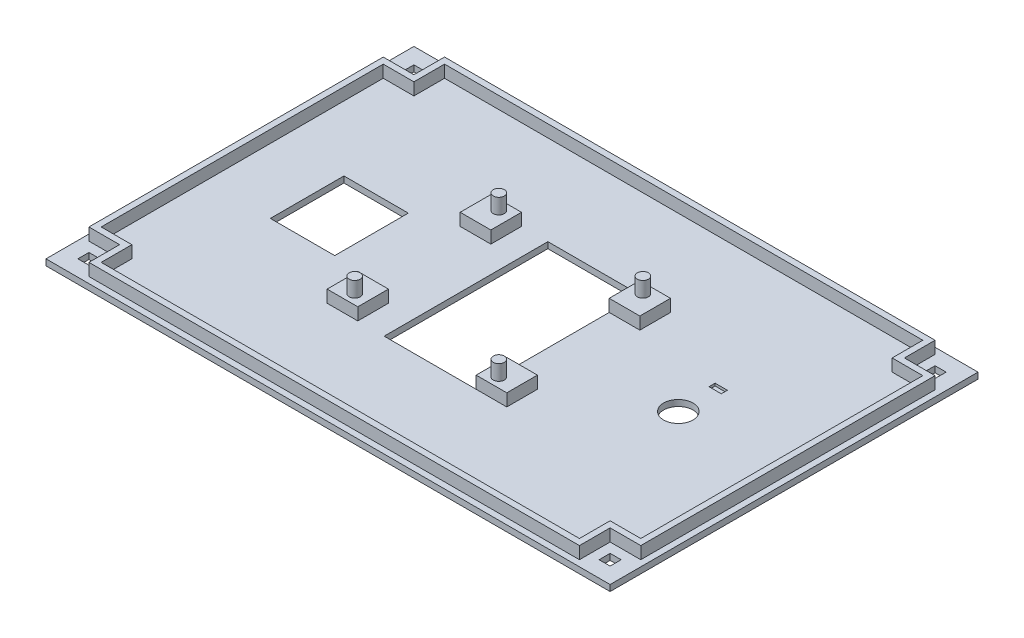
from build123d import *

# Parameters (mm, degrees)
SKETCH_1_W           = 92
SKETCH_1_H           = 60
EXTRUDE_1_DEPTH      = 1
EXTRUDE_3_DEPTH      = 2
SKETCH_6_W           = 1.8
SKETCH_6_H           = 1.8
CUT_EXTRUDE_3_DEPTH  = 1
SKETCH_7_W           = 1.8
SKETCH_7_H           = 1.8
CUT_EXTRUDE_4_DEPTH  = 1
SKETCH_8_W           = 1.8
SKETCH_8_H           = 1.8
CUT_EXTRUDE_5_DEPTH  = 1
SKETCH_9_W           = 1.8
SKETCH_9_H           = 1.8
CUT_EXTRUDE_6_DEPTH  = 1
SKETCH_15_W          = 15
SKETCH_15_H          = 26.7
CUT_EXTRUDE_8_DEPTH  = 1
SKETCH_18_W          = 5
SKETCH_18_H          = 5
EXTRUDE_4_DEPTH      = 2
SKETCH_19_R          = 0.9
EXTRUDE_5_DEPTH      = 2.5
SKETCH_10_W          = 10.5
SKETCH_10_H          = 12
CUT_EXTRUDE_9_DEPTH  = 1
SKETCH_20_R          = 2.4
CUT_EXTRUDE_11_DEPTH = 1
SKETCH_21_W          = 2
SKETCH_21_H          = 1
CUT_EXTRUDE_12_DEPTH = 0.4
CUT_EXTRUDE_13_DEPTH = 0.4


with BuildPart() as part:
    # Эскиз1 → Бобышка-Вытянуть1 (new body)
    with BuildSketch(Plane(origin=(0, 0, 0), x_dir=(1, 0, 0), z_dir=(0, 1, 0))):
        with Locations((46, 30)):
            Rectangle(SKETCH_1_W, SKETCH_1_H)
    extrude(amount=EXTRUDE_1_DEPTH)

    # Эскиз3 → Бобышка-Вытянуть3 (add)
    with BuildSketch(Plane(origin=(0, 1, 0), x_dir=(1, 0, 0), z_dir=(0, 1, 0))):
        Polygon((86, 54), (91, 54), (91, 6), (86, 6), (86, 1), (6, 1), (6, 6), (1, 6), (1, 54), (6, 54), (6, 59), (86, 59), align=None)
        Polygon((7, 58), (7, 53), (2, 53), (2, 7), (7, 7), (7, 2), (85, 2), (85, 7), (90, 7), (90, 53), (85, 53), (85, 58), align=None, mode=Mode.SUBTRACT)
    extrude(amount=EXTRUDE_3_DEPTH)

    # Эскиз6 → Вырез-Вытянуть3 (cut)
    with BuildSketch(Plane(origin=(0, 1, 0), x_dir=(1, 0, 0), z_dir=(0, 1, 0))):
        with Locations((3.5, 56.5)):
            Rectangle(SKETCH_6_W, SKETCH_6_H)
    extrude(amount=-CUT_EXTRUDE_3_DEPTH, mode=Mode.SUBTRACT)

    # Эскиз7 → Вырез-Вытянуть4 (cut)
    with BuildSketch(Plane(origin=(0, 1, 0), x_dir=(1, 0, 0), z_dir=(0, 1, 0))):
        with Locations((88.5, 56.5)):
            Rectangle(SKETCH_7_W, SKETCH_7_H)
    extrude(amount=-CUT_EXTRUDE_4_DEPTH, mode=Mode.SUBTRACT)

    # Эскиз8 → Вырез-Вытянуть5 (cut)
    with BuildSketch(Plane(origin=(0, 1, 0), x_dir=(1, 0, 0), z_dir=(0, 1, 0))):
        with Locations((88.5, 3.5)):
            Rectangle(SKETCH_8_W, SKETCH_8_H)
    extrude(amount=-CUT_EXTRUDE_5_DEPTH, mode=Mode.SUBTRACT)

    # Эскиз9 → Вырез-Вытянуть6 (cut)
    with BuildSketch(Plane(origin=(0, 1, 0), x_dir=(1, 0, 0), z_dir=(0, 1, 0))):
        with Locations((3.5, 3.5)):
            Rectangle(SKETCH_9_W, SKETCH_9_H)
    extrude(amount=-CUT_EXTRUDE_6_DEPTH, mode=Mode.SUBTRACT)

    # Эскиз15 → Вырез-Вытянуть8 (cut)
    with BuildSketch(Plane(origin=(0, 1, 0), x_dir=(1, 0, 0), z_dir=(0, 1, 0))):
        with Locations((46, 30)):
            Rectangle(SKETCH_15_W, SKETCH_15_H)
    extrude(amount=-CUT_EXTRUDE_8_DEPTH, mode=Mode.SUBTRACT)

    # Эскиз18 → Бобышка-Вытянуть4 (add)
    with BuildSketch(Plane(origin=(0, 1, 0), x_dir=(1, 0, 0), z_dir=(0, 1, 0))):
        with Locations((31.7, 40.85)):
            Rectangle(SKETCH_18_W, SKETCH_18_H)
        with Locations((31.7, 19.15)):
            Rectangle(SKETCH_18_W, SKETCH_18_H)
        with Locations((56, 40.85)):
            Rectangle(SKETCH_18_W, SKETCH_18_H)
        with Locations((56, 19.15)):
            Rectangle(SKETCH_18_W, SKETCH_18_H)
    extrude(amount=EXTRUDE_4_DEPTH)

    # Эскиз19 → Бобышка-Вытянуть5 (add)
    with BuildSketch(Plane(origin=(0, 3, 0), x_dir=(1, 0, 0), z_dir=(0, 1, 0))):
        with Locations((32.1, 41.75)):
            Circle(SKETCH_19_R)
        with Locations((32.1, 18.25)):
            Circle(SKETCH_19_R)
        with Locations((55.6, 41.75)):
            Circle(SKETCH_19_R)
        with Locations((55.6, 18.25)):
            Circle(SKETCH_19_R)
    extrude(amount=EXTRUDE_5_DEPTH)

    # Эскиз10 → Вырез-Вытянуть9 (cut)
    with BuildSketch(Plane(origin=(0, 1, 0), x_dir=(1, 0, 0), z_dir=(0, 1, 0))):
        with Locations((17.837788163, 30)):
            Rectangle(SKETCH_10_W, SKETCH_10_H)
    extrude(amount=-CUT_EXTRUDE_9_DEPTH, mode=Mode.SUBTRACT)

    # Эскиз20 → Вырез-Вытянуть11 (cut)
    with BuildSketch(Plane(origin=(0, 1, 0), x_dir=(1, 0, 0), z_dir=(0, 1, 0))):
        with Locations((73.124146683, 30)):
            Circle(SKETCH_20_R)
    extrude(amount=-CUT_EXTRUDE_11_DEPTH, mode=Mode.SUBTRACT)

    # Эскиз21 → Вырез-Вытянуть12 (cut)
    with BuildSketch(Plane(origin=(0, 1, 0), x_dir=(1, 0, 0), z_dir=(0, 1, 0))):
        with Locations((73.124146683, 36.5)):
            Rectangle(SKETCH_21_W, SKETCH_21_H)
    extrude(amount=-CUT_EXTRUDE_12_DEPTH, mode=Mode.SUBTRACT)

    # Эскиз22 → Вырез-Вытянуть13 (cut)
    # profile 1 of 19: a face of its own
    with BuildSketch(Plane(origin=(0, 0, 0), x_dir=(-1, 0, 0), z_dir=(0, -1, 0))):
        with BuildLine():
            Line((-6.570655821, 25.424472737), (-6.469404796, 25.859111284))
            add(Edge.make_bspline(
                [(-6.469404796, 25.859111284), (-6.42866707, 25.848222688), (-6.348979021, 25.826923244), (-6.234941019, 25.784806046), (-6.127904498, 25.737555442), (-6.028228713, 25.683932135), (-5.936347059, 25.62376797), (-5.851798196, 25.557325766), (-5.774447685, 25.484615344), (-5.705249825, 25.405078748), (-5.64335716, 25.320786828), (-5.590308991, 25.231149588), (-5.544050852, 25.13775734), (-5.506972443, 25.039082562), (-5.478848705, 24.935849752), (-5.458415772, 24.828316195), (-5.44581431, 24.716220632), (-5.444156624, 24.639810452), (-5.44331209, 24.600882082)],
                knots=[0, 0, 0, 0, 1.145367768, 2.240481511, 3.299486216, 4.322926322, 5.312543435, 6.280301985, 7.2416403, 8.192823262, 9.141388579, 10.079393599, 11.019812878, 11.970222822, 12.938950422, 13.923894909, 14.942295558, 16, 16, 16, 16], degree=3))
            add(Edge.make_bspline(
                [(-5.44331209, 24.600882082), (-5.443899781, 24.560942698), (-5.445049549, 24.482804485), (-5.454179645, 24.368307837), (-5.470558105, 24.259560116), (-5.491508604, 24.156173744), (-5.520271057, 24.058881927), (-5.554583179, 23.966980521), (-5.596126954, 23.881262605), (-5.64325851, 23.800821066), (-5.696831647, 23.726033128), (-5.755366986, 23.655188809), (-5.820484911, 23.590010412), (-5.890645542, 23.52886757), (-5.966775043, 23.473092173), (-6.047838988, 23.420632185), (-6.135265768, 23.37404816), (-6.227434476, 23.331613726), (-6.323452756, 23.294368116), (-6.421423981, 23.261418779), (-6.52154337, 23.234480895), (-6.622968435, 23.211289115), (-6.726552598, 23.194441411), (-6.831518662, 23.181064855), (-6.938510159, 23.173710156), (-7.010429062, 23.172742355), (-7.046659116, 23.172254813)],
                knots=[0, 0, 0, 0, 1.180680974, 2.309907975, 3.39230657, 4.430402719, 5.425739985, 6.38846843, 7.327253855, 8.238163682, 9.141319901, 10.044148192, 10.951882972, 11.861898394, 12.79276478, 13.739539846, 14.714057202, 15.718574761, 16.737652364, 17.7573291, 18.772768038, 19.801551793, 20.831755737, 21.873891013, 22.928945814, 24, 24, 24, 24], degree=3))
            add(Edge.make_bspline(
                [(-7.046659116, 23.172254813), (-7.085770876, 23.172952237), (-7.163045836, 23.17433017), (-7.277068033, 23.182105104), (-7.387110534, 23.196395531), (-7.493258994, 23.21620551), (-7.595742304, 23.241444119), (-7.694584556, 23.272170252), (-7.789383645, 23.308824995), (-7.880165198, 23.350454956), (-7.965820446, 23.3983352), (-8.047112416, 23.449875639), (-8.12245872, 23.50713182), (-8.193247002, 23.568128034), (-8.258272467, 23.634435586), (-8.317689317, 23.705839429), (-8.372037669, 23.781726863), (-8.420813468, 23.862085913), (-8.463611654, 23.945866435), (-8.501732378, 24.031823953), (-8.532977491, 24.120300374), (-8.558956548, 24.210594228), (-8.57963829, 24.30289991), (-8.593468235, 24.397433102), (-8.602480899, 24.494106454), (-8.603702331, 24.559291178), (-8.604319703, 24.592238701)],
                knots=[0, 0, 0, 0, 1.185610122, 2.34246615, 3.46204209, 4.547238403, 5.613845268, 6.659506797, 7.682407252, 8.692734231, 9.683951048, 10.654680354, 11.607833779, 12.549673105, 13.484816388, 14.419272854, 15.362680812, 16.31159957, 17.265732262, 18.21261905, 19.159670199, 20.10733745, 21.059306249, 22.024427552, 23.00144979, 24, 24, 24, 24], degree=3))
            add(Edge.make_bspline(
                [(-8.604319703, 24.592238701), (-8.603652237, 24.629108303), (-8.602340266, 24.701579156), (-8.590721426, 24.807782632), (-8.573311226, 24.909922408), (-8.547027641, 25.007202849), (-8.514784453, 25.100540365), (-8.473198343, 25.188464658), (-8.426078288, 25.272764465), (-8.37074248, 25.351878016), (-8.30900408, 25.426041853), (-8.241014787, 25.494587517), (-8.167224578, 25.557389804), (-8.087056239, 25.61367133), (-8.001050806, 25.664204492), (-7.909376708, 25.709532327), (-7.811449519, 25.748574864), (-7.743231079, 25.769454459), (-7.708495084, 25.780086093)],
                knots=[0, 0, 0, 0, 1.098215313, 2.158650937, 3.179873416, 4.182349117, 5.157851008, 6.118027029, 7.076341197, 8.032298369, 8.990121974, 9.948357669, 10.905435138, 11.873450097, 12.863034414, 13.874936208, 14.917943528, 16, 16, 16, 16], degree=3))
            Line((-7.708495084, 25.780086093), (-7.615270055, 25.345447547))
            add(Edge.make_bspline(
                [(-7.615270055, 25.345447547), (-7.641927536, 25.336911924), (-7.694104473, 25.320205069), (-7.768465881, 25.290540415), (-7.837497564, 25.258503577), (-7.900730274, 25.223331412), (-7.958179157, 25.184947695), (-8.010542419, 25.1442363), (-8.056842693, 25.100221824), (-8.098147547, 25.053799556), (-8.13333533, 25.00377074), (-8.164517496, 24.951308266), (-8.190315984, 24.895305965), (-8.212136175, 24.83656947), (-8.228743691, 24.774549778), (-8.240427734, 24.709499442), (-8.247189886, 24.641361307), (-8.248194152, 24.594928994), (-8.248706346, 24.571247635)],
                knots=[0, 0, 0, 0, 1.235697765, 2.418642872, 3.532555292, 4.594392283, 5.610119701, 6.580908344, 7.519430642, 8.427315627, 9.319973334, 10.216139639, 11.118687699, 12.038725643, 12.980015607, 13.949697744, 14.954307006, 16, 16, 16, 16], degree=3))
            add(Edge.make_bspline(
                [(-8.248706346, 24.571247635), (-8.248311504, 24.54405943), (-8.247534966, 24.490588254), (-8.239048929, 24.412029901), (-8.226523283, 24.336597086), (-8.207835559, 24.264803466), (-8.184238667, 24.196509333), (-8.156046818, 24.131405139), (-8.121735943, 24.069921589), (-8.082406539, 24.012121135), (-8.038255026, 23.958332122), (-7.990821012, 23.908365172), (-7.939993445, 23.862346005), (-7.885470108, 23.820826752), (-7.827051837, 23.783799683), (-7.765294928, 23.750291573), (-7.699786217, 23.721359095), (-7.607900086, 23.688657143), (-7.489324729, 23.656503936), (-7.344311841, 23.6279352), (-7.197137773, 23.609921214), (-7.098158192, 23.607904779), (-7.048511269, 23.60689336)],
                knots=[0, 0, 0, 0, 0.935100075, 1.839065892, 2.715632844, 3.564034634, 4.388093667, 5.199800233, 6.00171917, 6.806945003, 7.602082793, 8.393428172, 9.17553264, 9.958694158, 10.748327009, 11.553054559, 12.374096334, 13.209545573, 14.906836637, 16.595465087, 18.292327764, 20, 20, 20, 20], degree=3))
            add(Edge.make_bspline(
                [(-7.048511269, 23.60689336), (-6.986089569, 23.608046769), (-6.864781408, 23.610288264), (-6.689243263, 23.631868524), (-6.525589101, 23.665301569), (-6.398054296, 23.705251574), (-6.303847959, 23.745439215), (-6.237872901, 23.777935197), (-6.176823035, 23.815029589), (-6.120351314, 23.855798002), (-6.068622551, 23.900766021), (-6.021361937, 23.949307034), (-5.978114719, 24.001431916), (-5.940905377, 24.05775829), (-5.907866726, 24.116118084), (-5.878488127, 24.175774845), (-5.853641008, 24.236766133), (-5.834339262, 24.299338023), (-5.817659869, 24.362611838), (-5.806764107, 24.427284473), (-5.800614882, 24.493337486), (-5.799493107, 24.537690452), (-5.798925447, 24.560134718)],
                knots=[0, 0, 0, 0, 2.106854985, 4.094388766, 5.961441423, 7.741458329, 8.594569961, 9.418076185, 10.222480919, 11.003619353, 11.767127393, 12.533696482, 13.289066307, 14.050325982, 14.809648647, 15.552384038, 16.294338903, 17.030544626, 17.761979889, 18.502240791, 19.242077596, 20, 20, 20, 20], degree=3))
            add(Edge.make_bspline(
                [(-5.798925447, 24.560134718), (-5.799487167, 24.586918876), (-5.800596763, 24.639827059), (-5.810309118, 24.717397174), (-5.824621544, 24.792173695), (-5.846707062, 24.863250716), (-5.873748192, 24.931584302), (-5.907094634, 24.996614577), (-5.947200671, 25.058137031), (-5.992737308, 25.116875304), (-6.044550221, 25.171746209), (-6.102221977, 25.222032443), (-6.166015495, 25.267144877), (-6.234906982, 25.308975455), (-6.310954481, 25.344120829), (-6.391891351, 25.376673744), (-6.47904786, 25.403799184), (-6.53968118, 25.41748256), (-6.570655821, 25.424472737)],
                knots=[0, 0, 0, 0, 1.013374089, 2.001772144, 2.95501459, 3.891367103, 4.814208647, 5.733921849, 6.652182523, 7.590185968, 8.54346024, 9.504121027, 10.481158517, 11.497760682, 12.549996529, 13.647863555, 14.798406869, 16, 16, 16, 16], degree=3))
        make_face()
    # profile 2 of 19: a face of its own
    with BuildSketch(Plane(origin=(0, 0, 0), x_dir=(-1, 0, 0), z_dir=(0, -1, 0))):
        Polygon((-5.482824686, 27.163026924), (-8.209193751, 27.163026924), (-8.209193751, 26.175212045), (-8.564807107, 26.175212045), (-8.564807107, 28.585480349), (-8.209193751, 28.585480349), (-8.209193751, 27.59766547), (-5.482824686, 27.59766547), align=None)
    # profile 3 of 19: a face of its own
    with BuildSketch(Plane(origin=(0, 0, 0), x_dir=(-1, 0, 0), z_dir=(0, -1, 0))):
        Polygon((-5.482824686, 28.598445419), (-8.564807107, 29.8221011), (-8.564807107, 30.312304234), (-5.482824686, 31.535959915), (-5.482824686, 31.074773844), (-6.431126969, 30.724099562), (-6.431126969, 29.410305773), (-5.482824686, 29.059631491), align=None)
        with BuildLine():
            Line((-6.786740326, 29.541191244), (-6.786740326, 30.59321409))
            Line((-6.786740326, 30.59321409), (-7.596748526, 30.293782705))
            add(Edge.make_bspline(
                [(-7.596748526, 30.293782705), (-7.628046139, 30.282303575), (-7.689238882, 30.259859708), (-7.778146772, 30.22638914), (-7.862577353, 30.195810969), (-7.941320012, 30.165826561), (-8.015518565, 30.138759101), (-8.084671835, 30.113810329), (-8.148299173, 30.089136203), (-8.18940899, 30.074328914), (-8.209193751, 30.067202667)],
                knots=[0, 0, 0, 0, 1.225184869, 2.395467751, 3.491410812, 4.525364584, 5.492066482, 6.394148129, 7.227157926, 8, 8, 8, 8], degree=3))
            add(Edge.make_bspline(
                [(-8.209193751, 30.067202667), (-8.160416394, 30.05538553), (-8.062470839, 30.031656567), (-7.919065716, 29.982602177), (-7.777293459, 29.925566329), (-7.685972956, 29.879754666), (-7.639965427, 29.856674621)],
                knots=[0, 0, 0, 0, 0.989154277, 1.986234384, 2.985459177, 4, 4, 4, 4], degree=3))
            Line((-7.639965427, 29.856674621), (-6.786740326, 29.541191244))
        make_face(mode=Mode.SUBTRACT)
    # profile 4 of 19: a face of its own
    with BuildSketch(Plane(origin=(0, 0, 0), x_dir=(-1, 0, 0), z_dir=(0, -1, 0))):
        with BuildLine():
            Line((-5.482824686, 31.865025747), (-8.564807107, 31.865025747))
            Line((-8.564807107, 31.865025747), (-8.564807107, 32.997308551))
            add(Edge.make_bspline(
                [(-8.564807107, 32.997308551), (-8.564539731, 33.044240761), (-8.564037596, 33.132379671), (-8.558156955, 33.255464526), (-8.550881628, 33.36115949), (-8.540523454, 33.424999673), (-8.535790045, 33.454172933)],
                knots=[0, 0, 0, 0, 1.22865052, 2.30741144, 3.226532197, 4, 4, 4, 4], degree=3))
            add(Edge.make_bspline(
                [(-8.535790045, 33.454172933), (-8.529028905, 33.489788154), (-8.515911953, 33.558883475), (-8.482717393, 33.656093917), (-8.444028926, 33.745521834), (-8.39417145, 33.825471011), (-8.335962557, 33.89815412), (-8.26610319, 33.962267606), (-8.186275746, 34.0191097), (-8.096508556, 34.067440001), (-7.99992137, 34.107668366), (-7.897021967, 34.135844275), (-7.789598843, 34.153891045), (-7.716183373, 34.155790584), (-7.678860638, 34.156756265)],
                knots=[0, 0, 0, 0, 1.070963964, 2.077723998, 3.031409109, 3.947034396, 4.855896512, 5.777672756, 6.742175787, 7.747333477, 8.787332885, 9.830036646, 10.896840568, 12, 12, 12, 12], degree=3))
            add(Edge.make_bspline(
                [(-7.678860638, 34.156756265), (-7.646927322, 34.156075709), (-7.584096773, 34.154736676), (-7.491789627, 34.143238617), (-7.402986408, 34.125103689), (-7.318294771, 34.098052996), (-7.236724727, 34.064982757), (-7.159651468, 34.023306763), (-7.086030303, 33.974640418), (-7.016054347, 33.91880708), (-6.951171344, 33.853067705), (-6.896045733, 33.774007135), (-6.850069737, 33.682929919), (-6.81152558, 33.580562998), (-6.783413803, 33.465819886), (-6.76150012, 33.339647281), (-6.749726443, 33.201061712), (-6.748081964, 33.10475323), (-6.74722773, 33.054725291)],
                knots=[0, 0, 0, 0, 0.928734587, 1.827336177, 2.702165944, 3.561887964, 4.410255795, 5.259404997, 6.106313752, 6.974995773, 7.859929622, 8.783555066, 9.766301868, 10.821656499, 11.958701757, 13.197967894, 14.544469954, 16, 16, 16, 16], degree=3))
            Line((-6.74722773, 33.054725291), (-6.74722773, 32.299664293))
            Line((-6.74722773, 32.299664293), (-5.482824686, 32.299664293))
            Line((-5.482824686, 32.299664293), (-5.482824686, 31.865025747))
        make_face()
        with BuildLine():
            Line((-7.102841087, 32.299664293), (-7.102841087, 33.04299499))
            add(Edge.make_bspline(
                [(-7.102841087, 33.04299499), (-7.103338695, 33.072641308), (-7.104297291, 33.129752193), (-7.110936016, 33.212284985), (-7.12255733, 33.287993406), (-7.138374832, 33.357311063), (-7.159355737, 33.419723831), (-7.184438848, 33.475930209), (-7.214833999, 33.52508947), (-7.249894819, 33.567710097), (-7.289194646, 33.604281705), (-7.332050181, 33.636001626), (-7.37867225, 33.662744499), (-7.429151605, 33.68417138), (-7.482930117, 33.701879791), (-7.541029035, 33.713074677), (-7.602507074, 33.720826432), (-7.644878515, 33.721681255), (-7.666512952, 33.722117719)],
                knots=[0, 0, 0, 0, 1.40421292, 2.705086056, 3.918275699, 5.029558377, 6.068365212, 7.032404237, 7.938575147, 8.797260087, 9.638618655, 10.474993364, 11.317706051, 12.177828306, 13.068718597, 13.993981992, 14.975747128, 16, 16, 16, 16], degree=3))
            add(Edge.make_bspline(
                [(-7.666512952, 33.722117719), (-7.697885669, 33.721195832), (-7.758675041, 33.719409536), (-7.846166858, 33.701452155), (-7.926944323, 33.673214031), (-7.999645608, 33.633161105), (-8.062709721, 33.583626294), (-8.115710352, 33.527139091), (-8.156346429, 33.462215341), (-8.173407839, 33.414627917), (-8.182028842, 33.39058235)],
                knots=[0, 0, 0, 0, 1.143451971, 2.215610693, 3.244091205, 4.255765529, 5.229231363, 6.159234871, 7.069875225, 8, 8, 8, 8], degree=3))
            add(Edge.make_bspline(
                [(-8.182028842, 33.39058235), (-8.184187476, 33.381754378), (-8.188878337, 33.362570588), (-8.194202534, 33.33079279), (-8.199244076, 33.293963997), (-8.202588905, 33.251904686), (-8.205910745, 33.204998428), (-8.20744203, 33.153101824), (-8.208764625, 33.096096656), (-8.209046339, 33.056372705), (-8.209193751, 33.035586378)],
                knots=[0, 0, 0, 0, 0.611063981, 1.327884044, 2.165719042, 3.110592661, 4.16481496, 5.328235826, 6.601947678, 8, 8, 8, 8], degree=3))
            Line((-8.209193751, 33.035586378), (-8.209193751, 32.299664293))
            Line((-8.209193751, 32.299664293), (-7.102841087, 32.299664293))
        make_face(mode=Mode.SUBTRACT)
    # profile 5 of 19: a face of its own
    with BuildSketch(Plane(origin=(0, 0, 0), x_dir=(-1, 0, 0), z_dir=(0, -1, 0))):
        Polygon((-5.482824686, 35.460671905), (-8.209193751, 35.460671905), (-8.209193751, 34.472857027), (-8.564807107, 34.472857027), (-8.564807107, 36.883125331), (-8.209193751, 36.883125331), (-8.209193751, 35.895310452), (-5.482824686, 35.895310452), align=None)
    # profile 6 of 19: a face of its own
    with BuildSketch(Plane(origin=(0, 0, 0), x_dir=(-1, 0, 0), z_dir=(0, -1, 0))):
        with BuildLine():
            Line((-64.174693356, 41.054203842), (-64.490794117, 41.054203842))
            add(Edge.make_bspline(
                [(-64.490794117, 41.054203842), (-64.486314994, 41.084573701), (-64.477957245, 41.141241868), (-64.456640395, 41.218419293), (-64.426859406, 41.280549481), (-64.390167209, 41.329253258), (-64.345584748, 41.364660451), (-64.297145222, 41.393671519), (-64.242536648, 41.414428898), (-64.192436952, 41.426523544), (-64.146532776, 41.432316535), (-64.104217722, 41.437719455), (-64.054325287, 41.440910537), (-63.99691182, 41.444083618), (-63.93207281, 41.446405071), (-63.859634358, 41.448473056), (-63.779771814, 41.448639335), (-63.724002303, 41.449093496), (-63.694985755, 41.449329794)],
                knots=[0, 0, 0, 0, 1.447810451, 2.70151949, 3.761071597, 4.681645368, 5.550644144, 6.429888993, 7.336843752, 8.295347529, 8.854221167, 9.519029888, 10.307665071, 11.211965247, 12.232216441, 13.368617127, 14.630907028, 16, 16, 16, 16], degree=3))
            add(Edge.make_bspline(
                [(-63.694985755, 41.449329794), (-63.65629207, 41.449499573), (-63.58217048, 41.449824803), (-63.475710669, 41.454118012), (-63.37892755, 41.461419035), (-63.291616803, 41.471303461), (-63.213699173, 41.482912533), (-63.145693612, 41.499061098), (-63.087149765, 41.517316173), (-63.022233859, 41.544757685), (-62.953235849, 41.59025434), (-62.882123402, 41.656871497), (-62.824613218, 41.738370573), (-62.780408946, 41.83365436), (-62.746011398, 41.942256295), (-62.721692445, 42.065103297), (-62.70412593, 42.201875137), (-62.700045047, 42.297969224), (-62.697910112, 42.348241333)],
                knots=[0, 0, 0, 0, 1.168079359, 2.237571843, 3.215832227, 4.097464159, 4.89008186, 5.592324794, 6.205352649, 6.73969271, 7.715108044, 8.68195796, 9.666354411, 10.705682302, 11.841323562, 13.097561565, 14.481574619, 16, 16, 16, 16], degree=3))
            add(Edge.make_bspline(
                [(-62.697910112, 42.348241333), (-62.722657161, 42.311453134), (-62.770782121, 42.239912055), (-62.854025536, 42.144644926), (-62.944118629, 42.064587508), (-63.039836221, 41.997830299), (-63.142639054, 41.947178823), (-63.251270267, 41.91015278), (-63.36647997, 41.88820434), (-63.44546859, 41.885397623), (-63.485692478, 41.88396834)],
                knots=[0, 0, 0, 0, 1.110237516, 2.159050787, 3.15987179, 4.123962007, 5.074118526, 6.021584412, 6.992518568, 8, 8, 8, 8], degree=3))
            add(Edge.make_bspline(
                [(-63.485692478, 41.88396834), (-63.522576973, 41.884928096), (-63.594979339, 41.886812046), (-63.701275417, 41.901339716), (-63.802777475, 41.925054597), (-63.899169707, 41.959639359), (-63.991033742, 42.00251579), (-64.077272828, 42.056500148), (-64.159266649, 42.118966972), (-64.235415482, 42.190976744), (-64.30471568, 42.271292045), (-64.365377739, 42.358948992), (-64.416071646, 42.453825647), (-64.458685186, 42.554878466), (-64.490046839, 42.663412013), (-64.51400039, 42.778291976), (-64.527241316, 42.90007974), (-64.529270017, 42.983500232), (-64.530306712, 43.026129294)],
                knots=[0, 0, 0, 0, 1.017020763, 1.996359424, 2.953184604, 3.886712106, 4.815985037, 5.743748632, 6.687145925, 7.654818974, 8.628780691, 9.608086455, 10.58837866, 11.590850207, 12.627076538, 13.699062132, 14.824187913, 16, 16, 16, 16], degree=3))
            add(Edge.make_bspline(
                [(-64.530306712, 43.026129294), (-64.529817207, 43.058659015), (-64.528858795, 43.122349663), (-64.521829341, 43.215466101), (-64.511346036, 43.304276559), (-64.494051027, 43.388169861), (-64.474233829, 43.468227656), (-64.448758042, 43.543455004), (-64.419269599, 43.614456532), (-64.373313359, 43.70111143), (-64.309291727, 43.799845378), (-64.226347774, 43.907451875), (-64.134770148, 43.999021269), (-64.053178024, 44.06533064), (-63.98258761, 44.109740046), (-63.924954748, 44.137940764), (-63.862805003, 44.162112757), (-63.796140544, 44.181929293), (-63.72476789, 44.196227262), (-63.649210907, 44.207773419), (-63.568920962, 44.2135035), (-63.513893067, 44.214632742), (-63.485692478, 44.215211454)],
                knots=[0, 0, 0, 0, 1.093679396, 2.141338684, 3.138679113, 4.098139365, 5.019539308, 5.910153341, 6.766085864, 7.601779376, 9.204576951, 10.717610798, 12.161066056, 13.549758896, 14.242914697, 14.960875658, 15.70361923, 16.483073066, 17.295995467, 18.149350719, 19.051582818, 20, 20, 20, 20], degree=3))
            add(Edge.make_bspline(
                [(-63.485692478, 44.215211454), (-63.453165127, 44.214520436), (-63.389657134, 44.213171259), (-63.297152293, 44.205560338), (-63.210152154, 44.191059965), (-63.128547295, 44.171922674), (-63.052990763, 44.145502595), (-62.9825343, 44.114958042), (-62.918029104, 44.077714644), (-62.840014479, 44.020444273), (-62.752124558, 43.938685351), (-62.658328571, 43.828858975), (-62.579375828, 43.705124906), (-62.52304175, 43.591983974), (-62.486380532, 43.489577755), (-62.461775304, 43.399238574), (-62.442117583, 43.295517441), (-62.424707623, 43.179200668), (-62.412206514, 43.049566677), (-62.403107388, 42.906877984), (-62.397596022, 42.751024827), (-62.396957752, 42.642738204), (-62.396626574, 42.586551673)],
                knots=[0, 0, 0, 0, 0.870162468, 1.698947864, 2.479922643, 3.227576458, 3.937819425, 4.618010934, 5.278930023, 5.925246229, 7.203096592, 8.480223527, 9.778049416, 11.119750235, 11.851054765, 12.684343125, 13.621387403, 14.67311213, 15.829366811, 17.103607822, 18.497152973, 20, 20, 20, 20], degree=3))
            add(Edge.make_bspline(
                [(-62.396626574, 42.586551673), (-62.396857024, 42.550534798), (-62.397307517, 42.480127604), (-62.401026164, 42.376570274), (-62.407401514, 42.277589113), (-62.414811882, 42.182984885), (-62.426555567, 42.093134858), (-62.438754409, 42.007488699), (-62.455338488, 41.926518497), (-62.472774269, 41.84994996), (-62.49340155, 41.777900191), (-62.515941155, 41.710203048), (-62.541166342, 41.647045871), (-62.56927252, 41.58862223), (-62.59912508, 41.534307971), (-62.631964283, 41.484921985), (-62.666824771, 41.439725373), (-62.716989094, 41.385771936), (-62.786806753, 41.325395584), (-62.879997813, 41.262611533), (-62.983831856, 41.210211645), (-63.097965269, 41.167516493), (-63.222317, 41.134612132), (-63.356916053, 41.110591527), (-63.501855626, 41.09649805), (-63.601934871, 41.09466376), (-63.653621007, 41.093716437)],
                knots=[0, 0, 0, 0, 1.13881432, 2.226198728, 3.275858376, 4.27502977, 5.225799353, 6.140548384, 7.009603692, 7.838254902, 8.623026674, 9.378213121, 10.093548719, 10.771691928, 11.427101133, 12.051544054, 12.645081569, 13.229887208, 14.37825414, 15.554957591, 16.774302763, 18.046932979, 19.401235528, 20.835896622, 22.365892172, 24, 24, 24, 24], degree=3))
            add(Edge.make_bspline(
                [(-63.653621007, 41.093716437), (-63.68490202, 41.093778095), (-63.743966274, 41.093894516), (-63.827312196, 41.093128185), (-63.899957234, 41.0924751), (-63.961907623, 41.092106073), (-64.012946993, 41.090798821), (-64.053268473, 41.089451695), (-64.082965576, 41.088691409), (-64.107479176, 41.086241762), (-64.128920692, 41.08311534), (-64.148766647, 41.075935975), (-64.165021634, 41.067469809), (-64.171645922, 41.058383776), (-64.174693356, 41.054203842)],
                knots=[0, 0, 0, 0, 2.121546565, 4.005866589, 5.652915826, 7.048739931, 8.207552293, 9.115221962, 9.785765347, 10.220470559, 10.787256812, 11.246373005, 11.65330182, 12, 12, 12, 12], degree=3))
        make_face()
        with BuildLine():
            add(Edge.make_bspline(
                [(-64.13518076, 43.012546839), (-64.134766344, 42.984950057), (-64.133951131, 42.930663551), (-64.125776778, 42.851203888), (-64.112453567, 42.775575394), (-64.092895368, 42.704082375), (-64.069244401, 42.636085572), (-64.039369367, 42.572010116), (-64.003884071, 42.512116369), (-63.964268394, 42.455570836), (-63.918340148, 42.405392239), (-63.869074845, 42.360058278), (-63.814110711, 42.322964085), (-63.754914694, 42.292696704), (-63.69157369, 42.268012899), (-63.623350886, 42.252161696), (-63.551101204, 42.240820839), (-63.501381162, 42.2400025), (-63.475814329, 42.239581697)],
                knots=[0, 0, 0, 0, 1.155215058, 2.272460246, 3.340711256, 4.367059194, 5.372760775, 6.351976122, 7.321474712, 8.285134748, 9.23693223, 10.164389501, 11.08218885, 12.003299378, 12.944308493, 13.92033371, 14.930602667, 16, 16, 16, 16], degree=3))
            add(Edge.make_bspline(
                [(-63.475814329, 42.239581697), (-63.449230861, 42.240302863), (-63.397494811, 42.241706378), (-63.322143931, 42.252334182), (-63.25140421, 42.269988284), (-63.185481428, 42.295720069), (-63.123801686, 42.327682183), (-63.067385168, 42.367635297), (-63.01554802, 42.414457018), (-62.968830962, 42.468353094), (-62.927010586, 42.527931928), (-62.891116517, 42.592921841), (-62.860129523, 42.662236553), (-62.834641685, 42.736565792), (-62.816006537, 42.816081562), (-62.801502293, 42.899939222), (-62.793772374, 42.988736778), (-62.792437126, 43.049371056), (-62.791752525, 43.080459112)],
                knots=[0, 0, 0, 0, 1.041244924, 2.026443639, 2.974894649, 3.891272878, 4.792918297, 5.689937269, 6.591907093, 7.523343527, 8.478488283, 9.438622723, 10.427575594, 11.450045322, 12.511939121, 13.624070938, 14.781827365, 16, 16, 16, 16], degree=3))
            add(Edge.make_bspline(
                [(-62.791752525, 43.080459112), (-62.792300152, 43.111147772), (-62.793361329, 43.170615466), (-62.802837894, 43.257120368), (-62.81806694, 43.338109285), (-62.839385565, 43.413723474), (-62.86770402, 43.483357471), (-62.900495249, 43.548175689), (-62.941405319, 43.606594953), (-62.987438498, 43.659515631), (-63.038172534, 43.706149701), (-63.091467287, 43.747426209), (-63.148001845, 43.78210025), (-63.207433537, 43.810910649), (-63.270244589, 43.832085684), (-63.335362845, 43.848632645), (-63.403523063, 43.857817793), (-63.44985878, 43.858999255), (-63.473344792, 43.859598098)],
                knots=[0, 0, 0, 0, 1.262646941, 2.446724699, 3.576235582, 4.651178906, 5.673450157, 6.665921952, 7.633842012, 8.600278783, 9.547183505, 10.465319824, 11.370275434, 12.271856035, 13.177168262, 14.093310203, 15.03356323, 16, 16, 16, 16], degree=3))
            add(Edge.make_bspline(
                [(-63.473344792, 43.859598098), (-63.497250064, 43.858840863), (-63.544266034, 43.857351561), (-63.613385213, 43.846930329), (-63.678753291, 43.828258734), (-63.740827526, 43.802779631), (-63.798978777, 43.76958865), (-63.854610174, 43.73008836), (-63.905650569, 43.682028149), (-63.953194372, 43.627640905), (-63.99617443, 43.567562925), (-64.033434704, 43.502114561), (-64.06493619, 43.432004701), (-64.090911082, 43.357254576), (-64.110539426, 43.277638214), (-64.124602996, 43.193432232), (-64.133365718, 43.104515138), (-64.134567076, 43.043642277), (-64.13518076, 43.012546839)],
                knots=[0, 0, 0, 0, 0.951844141, 1.872050474, 2.774796237, 3.652881009, 4.537176522, 5.435485427, 6.36325005, 7.321457585, 8.308353997, 9.299358464, 10.31529039, 11.364870983, 12.446061216, 13.576351534, 14.761937466, 16, 16, 16, 16], degree=3))
        make_face(mode=Mode.SUBTRACT)
    # profile 7 of 19: a face of its own
    with BuildSketch(Plane(origin=(0, 0, 0), x_dir=(-1, 0, 0), z_dir=(0, -1, 0))):
        with BuildLine():
            Line((-66.50161478, 43.503984742), (-66.888714735, 43.543497337))
            add(Edge.make_bspline(
                [(-66.888714735, 43.543497337), (-66.880777913, 43.569608463), (-66.865164632, 43.620974156), (-66.833480435, 43.693822055), (-66.798681508, 43.763047164), (-66.757501367, 43.827065287), (-66.712645239, 43.88739565), (-66.662165955, 43.942563136), (-66.607013173, 43.99336429), (-66.547026146, 44.039818628), (-66.482163831, 44.081185234), (-66.412868321, 44.116966611), (-66.339295487, 44.147340111), (-66.261605032, 44.172817094), (-66.179102323, 44.191766409), (-66.092614851, 44.204948345), (-66.001940274, 44.214249692), (-65.940025705, 44.214885663), (-65.908308468, 44.215211454)],
                knots=[0, 0, 0, 0, 1.017323781, 2.001274869, 2.959303191, 3.905007698, 4.837087975, 5.761037643, 6.69017245, 7.631566209, 8.587870128, 9.556241258, 10.537222351, 11.554546132, 12.603058264, 13.691134057, 14.817227518, 16, 16, 16, 16], degree=3))
            add(Edge.make_bspline(
                [(-65.908308468, 44.215211454), (-65.868560711, 44.214165519), (-65.790885867, 44.212121557), (-65.677413769, 44.199029918), (-65.570779782, 44.174340066), (-65.469870824, 44.142135048), (-65.375880111, 44.098881331), (-65.287089102, 44.04797511), (-65.206302713, 43.985313791), (-65.131250695, 43.914976604), (-65.063671091, 43.835977992), (-65.00586406, 43.74829486), (-64.955754153, 43.65384645), (-64.915893417, 43.551148587), (-64.884389063, 43.441215745), (-64.862529557, 43.323583968), (-64.848543975, 43.198718852), (-64.847131957, 43.112808183), (-64.846407473, 43.068728811)],
                knots=[0, 0, 0, 0, 1.077514581, 2.105672966, 3.089476038, 4.040274705, 4.971431025, 5.888919861, 6.808238254, 7.735577247, 8.673393093, 9.618677744, 10.576827782, 11.566071718, 12.598940494, 13.672172662, 14.805629521, 16, 16, 16, 16], degree=3))
            add(Edge.make_bspline(
                [(-64.846407473, 43.068728811), (-64.84713178, 43.023005756), (-64.848538162, 42.934225521), (-64.862464726, 42.80478895), (-64.884972155, 42.683342976), (-64.916485569, 42.569403782), (-64.956868209, 42.463430439), (-65.007729752, 42.365777157), (-65.065909257, 42.275045506), (-65.134352806, 42.193585606), (-65.209404951, 42.120915355), (-65.290325372, 42.057432719), (-65.376287499, 42.003127274), (-65.468437587, 41.960084336), (-65.565405096, 41.925888244), (-65.667709286, 41.90098806), (-65.775791301, 41.88686742), (-65.849616423, 41.884948363), (-65.887317402, 41.88396834)],
                knots=[0, 0, 0, 0, 1.232146047, 2.392452017, 3.504407964, 4.558277538, 5.575096589, 6.555128708, 7.521420677, 8.47461407, 9.41617836, 10.332834734, 11.24251511, 12.150739645, 13.068352328, 14.010194393, 14.983847001, 16, 16, 16, 16], degree=3))
            add(Edge.make_bspline(
                [(-65.887317402, 41.88396834), (-65.923796136, 41.884900028), (-65.995186082, 41.886723368), (-66.099733672, 41.901545526), (-66.19957974, 41.924260608), (-66.293623447, 41.958876323), (-66.383021017, 42.001642435), (-66.467055546, 42.054290458), (-66.546103679, 42.116608996), (-66.61935295, 42.188195278), (-66.686114875, 42.268106492), (-66.743829942, 42.356704887), (-66.792910235, 42.45284884), (-66.832122282, 42.557162588), (-66.86301465, 42.668758303), (-66.88496509, 42.787946734), (-66.898937738, 42.914872765), (-66.900341035, 43.002218815), (-66.901062421, 43.04712036)],
                knots=[0, 0, 0, 0, 1.005369277, 1.967536996, 2.906194001, 3.82340783, 4.724347318, 5.634371901, 6.551585731, 7.494554804, 8.453555035, 9.416726127, 10.403884227, 11.423989226, 12.484028395, 13.59247144, 14.762373872, 16, 16, 16, 16], degree=3))
            add(Edge.make_bspline(
                [(-66.901062421, 43.04712036), (-66.900876213, 43.061320547), (-66.900433602, 43.095073995), (-66.899658995, 43.128821542), (-66.899210268, 43.148371385)],
                knots=[0, 0, 0, 0, 0.841406606, 2, 2, 2, 2], degree=3))
            Line((-66.899210268, 43.148371385), (-65.241533425, 43.148371385))
            add(Edge.make_bspline(
                [(-65.241533425, 43.148371385), (-65.243820902, 43.176198438), (-65.248296123, 43.230639276), (-65.26134652, 43.30945957), (-65.278958348, 43.383534479), (-65.302665935, 43.452211794), (-65.330672522, 43.516260591), (-65.365283836, 43.574627676), (-65.403844179, 43.628608261), (-65.448147601, 43.676890358), (-65.495964815, 43.719825372), (-65.547116041, 43.757530698), (-65.601435277, 43.788559403), (-65.658133818, 43.8153113), (-65.718211585, 43.834640882), (-65.780997464, 43.848957624), (-65.846734105, 43.857772221), (-65.89161196, 43.858981721), (-65.914482311, 43.859598098)],
                knots=[0, 0, 0, 0, 1.224701267, 2.396005229, 3.502034591, 4.561483905, 5.58012448, 6.563575487, 7.533543345, 8.485993125, 9.432387909, 10.349909037, 11.268362855, 12.173401338, 13.095753308, 14.031141616, 14.99664363, 16, 16, 16, 16], degree=3))
            add(Edge.make_bspline(
                [(-65.914482311, 43.859598098), (-65.947874078, 43.858482432), (-66.01235938, 43.856327887), (-66.105787072, 43.841128191), (-66.191190503, 43.813672654), (-66.269903656, 43.776577736), (-66.340715645, 43.727181438), (-66.403176205, 43.66473314), (-66.458071677, 43.589895763), (-66.48677467, 43.533264441), (-66.50161478, 43.503984742)],
                knots=[0, 0, 0, 0, 1.096716534, 2.117950163, 3.097018359, 4.034242303, 4.966210859, 5.917371264, 6.923232884, 8, 8, 8, 8], degree=3))
        make_face()
        with BuildLine():
            Line((-65.241533425, 42.792758029), (-66.50593647, 42.792758029))
            add(Edge.make_bspline(
                [(-66.50593647, 42.792758029), (-66.503452156, 42.773179799), (-66.498594778, 42.734900078), (-66.488318591, 42.679551507), (-66.474856323, 42.628104709), (-66.45795865, 42.58067904), (-66.438394074, 42.536751898), (-66.415533945, 42.49673424), (-66.39025168, 42.460208238), (-66.370576532, 42.438989605), (-66.360851159, 42.428501292)],
                knots=[0, 0, 0, 0, 1.185375606, 2.317668634, 3.379182944, 4.376256932, 5.339019372, 6.263642956, 7.141723434, 8, 8, 8, 8], degree=3))
            add(Edge.make_bspline(
                [(-66.360851159, 42.428501292), (-66.3453414, 42.413300826), (-66.314589359, 42.383162037), (-66.262890422, 42.345014918), (-66.208190808, 42.312707997), (-66.150304822, 42.285949846), (-66.088928844, 42.264796867), (-66.023918077, 42.25014977), (-65.955672694, 42.241432154), (-65.909157346, 42.240206149), (-65.885465249, 42.239581697)],
                knots=[0, 0, 0, 0, 0.989757336, 1.962445513, 2.922132607, 3.884113302, 4.866899171, 5.878154413, 6.919260533, 8, 8, 8, 8], degree=3))
            add(Edge.make_bspline(
                [(-65.885465249, 42.239581697), (-65.86384051, 42.240098365), (-65.821306997, 42.241114596), (-65.758911946, 42.247853829), (-65.699185217, 42.259560015), (-65.642271228, 42.276422886), (-65.587600514, 42.29734122), (-65.535577822, 42.323213252), (-65.486726496, 42.354526055), (-65.440279431, 42.389402499), (-65.398244815, 42.428819701), (-65.359774508, 42.47075333), (-65.32793197, 42.517114211), (-65.299696796, 42.56572532), (-65.277588944, 42.618108287), (-65.260184536, 42.673490229), (-65.247795348, 42.732024109), (-65.243639331, 42.772333003), (-65.241533425, 42.792758029)],
                knots=[0, 0, 0, 0, 1.102665462, 2.168823275, 3.195785124, 4.201947785, 5.191946361, 6.177485462, 7.158600939, 8.147152392, 9.134756502, 10.093390301, 11.042499578, 11.996585016, 12.955620794, 13.934713813, 14.953493427, 16, 16, 16, 16], degree=3))
        make_face(mode=Mode.SUBTRACT)
    # profile 8 of 19: a face of its own
    with BuildSketch(Plane(origin=(0, 0, 0), x_dir=(-1, 0, 0), z_dir=(0, -1, 0))):
        with BuildLine():
            Line((-67.8888773, 43.148371385), (-67.8888773, 42.792758029))
            add(Edge.make_bspline(
                [(-67.8888773, 42.792758029), (-67.924479526, 42.792229721), (-67.989729377, 42.791261466), (-68.078292229, 42.788729056), (-68.148477337, 42.783627193), (-68.203421579, 42.778310037), (-68.248763388, 42.767421337), (-68.289657441, 42.749230527), (-68.329928506, 42.725345448), (-68.367494463, 42.69425336), (-68.400546186, 42.657894418), (-68.424602574, 42.615384613), (-68.439220132, 42.568351593), (-68.441097595, 42.535412541), (-68.442053632, 42.5186394)],
                knots=[0, 0, 0, 0, 1.839295496, 3.370962123, 4.575177622, 5.474416927, 6.219515099, 6.97185766, 7.777649614, 8.631047526, 9.482058678, 10.300857652, 11.134767037, 12, 12, 12, 12], degree=3))
            add(Edge.make_bspline(
                [(-68.442053632, 42.5186394), (-68.440984317, 42.49830934), (-68.438916045, 42.458986903), (-68.419408845, 42.403414151), (-68.387608589, 42.354569335), (-68.34371025, 42.313361931), (-68.290312735, 42.279772557), (-68.22843939, 42.256866826), (-68.159772519, 42.242123675), (-68.111630323, 42.240454881), (-68.086440276, 42.239581697)],
                knots=[0, 0, 0, 0, 0.960482297, 1.857766531, 2.752929272, 3.697693933, 4.687808438, 5.721744542, 6.807919688, 8, 8, 8, 8], degree=3))
            add(Edge.make_bspline(
                [(-68.086440276, 42.239581697), (-68.061458542, 42.240453633), (-68.013081198, 42.242142145), (-67.943462014, 42.257395746), (-67.879591205, 42.28221484), (-67.821413388, 42.317148602), (-67.769505038, 42.362538943), (-67.723656451, 42.417703939), (-67.682995674, 42.48236759), (-67.662451479, 42.530652439), (-67.651801729, 42.555682458)],
                knots=[0, 0, 0, 0, 1.040390029, 2.014724385, 2.954721802, 3.886105131, 4.828800269, 5.815260075, 6.8674691, 8, 8, 8, 8], degree=3))
            Line((-67.651801729, 42.555682458), (-67.217163182, 42.516169863))
            add(Edge.make_bspline(
                [(-67.217163182, 42.516169863), (-67.224652765, 42.490546544), (-67.239306951, 42.440411725), (-67.266442808, 42.368449411), (-67.298200485, 42.30189155), (-67.33251261, 42.239511497), (-67.371681134, 42.182707806), (-67.414284981, 42.130301131), (-67.461438101, 42.083624919), (-67.511660607, 42.040958959), (-67.566153466, 42.004224382), (-67.624006452, 41.971605785), (-67.685937448, 41.944620038), (-67.75179478, 41.922233206), (-67.821449652, 41.905187909), (-67.894896216, 41.892807588), (-67.972067946, 41.885320555), (-68.024890736, 41.884425457), (-68.051866755, 41.88396834)],
                knots=[0, 0, 0, 0, 1.122723975, 2.196732005, 3.230673319, 4.222855838, 5.188123969, 6.129175962, 7.05961643, 7.975157846, 8.897183724, 9.819575283, 10.765353715, 11.734457287, 12.742265098, 13.778342395, 14.865423827, 16, 16, 16, 16], degree=3))
            add(Edge.make_bspline(
                [(-68.051866755, 41.88396834), (-68.081726257, 41.88459009), (-68.139927918, 41.885801995), (-68.224812631, 41.894371297), (-68.304484585, 41.909167324), (-68.379400477, 41.929450654), (-68.449174582, 41.956142825), (-68.514517004, 41.987935356), (-68.574095494, 42.02692045), (-68.628980081, 42.070246082), (-68.677217749, 42.118572475), (-68.720400542, 42.168487149), (-68.756477722, 42.221280708), (-68.785660075, 42.276676748), (-68.80851282, 42.334253236), (-68.825434893, 42.393964897), (-68.835560828, 42.455935646), (-68.836636753, 42.498022802), (-68.837179584, 42.519256784)],
                knots=[0, 0, 0, 0, 1.26861264, 2.472759363, 3.620071859, 4.708286775, 5.765461966, 6.789986675, 7.789237632, 8.784732425, 9.755457947, 10.685846931, 11.585614755, 12.465665484, 13.340837652, 14.212815352, 15.098322335, 16, 16, 16, 16], degree=3))
            add(Edge.make_bspline(
                [(-68.837179584, 42.519256784), (-68.836206865, 42.540532065), (-68.834286354, 42.58253743), (-68.819643582, 42.643940202), (-68.795304055, 42.701821682), (-68.761281701, 42.756348793), (-68.717589518, 42.807330326), (-68.663660685, 42.854104558), (-68.601010024, 42.898274307), (-68.554500017, 42.923503058), (-68.530339587, 42.936608571)],
                knots=[0, 0, 0, 0, 0.932066351, 1.840247736, 2.750085694, 3.673906612, 4.646612121, 5.682062844, 6.795907315, 8, 8, 8, 8], degree=3))
            add(Edge.make_bspline(
                [(-68.530339587, 42.936608571), (-68.557958733, 42.952586087), (-68.611591188, 42.983612153), (-68.682554494, 43.040466997), (-68.742777818, 43.103449801), (-68.792244977, 43.173184759), (-68.829947902, 43.250046613), (-68.857427423, 43.333062959), (-68.873572728, 43.422895518), (-68.875632031, 43.484985375), (-68.876692179, 43.516949812)],
                knots=[0, 0, 0, 0, 1.071664795, 2.081020633, 3.045249586, 3.99365648, 4.9437028, 5.913082532, 6.925635428, 8, 8, 8, 8], degree=3))
            add(Edge.make_bspline(
                [(-68.876692179, 43.516949812), (-68.876249575, 43.542308205), (-68.875381888, 43.592021176), (-68.86414257, 43.664491139), (-68.848059739, 43.733653438), (-68.823493496, 43.798635504), (-68.793094748, 43.860386895), (-68.756101414, 43.918579494), (-68.711742672, 43.972652721), (-68.660928913, 44.022562712), (-68.604581468, 44.06846738), (-68.541391577, 44.107357048), (-68.473280355, 44.140588618), (-68.400129515, 44.168788282), (-68.321185768, 44.189514597), (-68.23688821, 44.203999729), (-68.14736879, 44.21359062), (-68.085848574, 44.21466244), (-68.054336292, 44.215211454)],
                knots=[0, 0, 0, 0, 0.999062271, 1.958576534, 2.885692741, 3.794729737, 4.691217627, 5.596260752, 6.507613401, 7.443039959, 8.401249088, 9.367330758, 10.361833641, 11.386767042, 12.45376505, 13.574562247, 14.757626642, 16, 16, 16, 16], degree=3))
            add(Edge.make_bspline(
                [(-68.054336292, 44.215211454), (-68.023654473, 44.214587426), (-67.963811825, 44.213370305), (-67.876462952, 44.204818082), (-67.794150436, 44.189912574), (-67.716537324, 44.169811628), (-67.644222453, 44.143218821), (-67.576727604, 44.110904173), (-67.51432514, 44.072520234), (-67.456389257, 44.028503658), (-67.403812934, 43.97837569), (-67.356518072, 43.922060378), (-67.313997456, 43.86022604), (-67.27591755, 43.792636593), (-67.244356593, 43.718632146), (-67.216095873, 43.639456545), (-67.194246993, 43.553975124), (-67.183272967, 43.494793151), (-67.177650587, 43.464472146)],
                knots=[0, 0, 0, 0, 1.149644563, 2.242297768, 3.28447786, 4.2814273, 5.242664331, 6.167002941, 7.080892691, 7.98315883, 8.888582975, 9.79695778, 10.733852572, 11.697067205, 12.69850991, 13.744790175, 14.844576737, 16, 16, 16, 16], degree=3))
            Line((-67.177650587, 43.464472146), (-67.612289134, 43.424959551))
            add(Edge.make_bspline(
                [(-67.612289134, 43.424959551), (-67.620030867, 43.458042017), (-67.634926278, 43.521694038), (-67.674520876, 43.608531286), (-67.722889851, 43.685032308), (-67.784403476, 43.74699899), (-67.851883383, 43.79780682), (-67.926119502, 43.833055503), (-68.00478297, 43.856302753), (-68.059313385, 43.858486858), (-68.08705766, 43.859598098)],
                knots=[0, 0, 0, 0, 1.161929031, 2.23559913, 3.254990029, 4.247745135, 5.211401429, 6.135839433, 7.051542478, 8, 8, 8, 8], degree=3))
            add(Edge.make_bspline(
                [(-68.08705766, 43.859598098), (-68.114142633, 43.858548022), (-68.166778446, 43.856507348), (-68.242210888, 43.83668099), (-68.310825127, 43.804383727), (-68.370162035, 43.758989747), (-68.420581654, 43.705301502), (-68.455256612, 43.641589052), (-68.478385841, 43.571830559), (-68.480488181, 43.522493008), (-68.481566227, 43.497193514)],
                knots=[0, 0, 0, 0, 1.08365366, 2.105927555, 3.102045451, 4.103374469, 5.084317192, 6.029659502, 6.989641439, 8, 8, 8, 8], degree=3))
            add(Edge.make_bspline(
                [(-68.481566227, 43.497193514), (-68.480836821, 43.477348611), (-68.479405327, 43.438402046), (-68.465088644, 43.38213285), (-68.44294293, 43.329596318), (-68.411861603, 43.282623654), (-68.376418809, 43.241934174), (-68.338042888, 43.209649464), (-68.299943445, 43.183769503), (-68.256674756, 43.167281753), (-68.204871213, 43.158127696), (-68.139724217, 43.150861511), (-68.058289761, 43.146968157), (-67.998568511, 43.146677497), (-67.966050337, 43.146519232)],
                knots=[0, 0, 0, 0, 0.995299735, 1.953322946, 2.898311219, 3.847645587, 4.770770215, 5.599604567, 6.362544303, 7.073018282, 7.906483748, 8.999277799, 10.366109098, 12, 12, 12, 12], degree=3))
            add(Edge.make_bspline(
                [(-67.966050337, 43.146519232), (-67.962345437, 43.146488323), (-67.953079377, 43.146411018), (-67.936420729, 43.147315903), (-67.914396593, 43.147782595), (-67.897932198, 43.148162467), (-67.8888773, 43.148371385)],
                knots=[0, 0, 0, 0, 0.575798422, 1.440088237, 2.592129284, 4, 4, 4, 4], degree=3))
        make_face()
    # profile 9 of 19: a face of its own
    with BuildSketch(Plane(origin=(0, 0, 0), x_dir=(-1, 0, 0), z_dir=(0, -1, 0))):
        Polygon((-70.154060294, 44.175698859), (-71.377715975, 41.093716437), (-71.867919109, 41.093716437), (-73.09157479, 44.175698859), (-72.630388718, 44.175698859), (-72.279714436, 43.227396576), (-70.965920647, 43.227396576), (-70.615246365, 44.175698859), align=None)
        with BuildLine():
            Line((-71.096806119, 42.871783219), (-72.148828965, 42.871783219))
            Line((-72.148828965, 42.871783219), (-71.84939758, 42.061775019))
            add(Edge.make_bspline(
                [(-71.84939758, 42.061775019), (-71.837918449, 42.030477406), (-71.815474582, 41.969284663), (-71.782004015, 41.880376773), (-71.751425844, 41.795946192), (-71.721441436, 41.717203533), (-71.694373975, 41.643004979), (-71.669425203, 41.57385171), (-71.644751078, 41.510224371), (-71.629943788, 41.469114555), (-71.622817542, 41.449329794)],
                knots=[0, 0, 0, 0, 1.225184869, 2.395467751, 3.491410812, 4.525364584, 5.492066482, 6.394148129, 7.227157926, 8, 8, 8, 8], degree=3))
            add(Edge.make_bspline(
                [(-71.622817542, 41.449329794), (-71.611000404, 41.498107151), (-71.587271441, 41.596052706), (-71.538217051, 41.739457829), (-71.481181203, 41.881230086), (-71.435369541, 41.972550589), (-71.412289496, 42.018558118)],
                knots=[0, 0, 0, 0, 0.989154277, 1.986234384, 2.985459177, 4, 4, 4, 4], degree=3))
            Line((-71.412289496, 42.018558118), (-71.096806119, 42.871783219))
        make_face(mode=Mode.SUBTRACT)
    # profile 10 of 19: a face of its own
    with BuildSketch(Plane(origin=(0, 0, 0), x_dir=(-1, 0, 0), z_dir=(0, -1, 0))):
        Polygon((-73.420640621, 44.175698859), (-73.420640621, 41.093716437), (-73.855279168, 41.093716437), (-73.855279168, 43.820085503), (-75.317245189, 43.820085503), (-75.317245189, 44.175698859), align=None)
    # profile 11 of 19: a face of its own
    with BuildSketch(Plane(origin=(0, 0, 0), x_dir=(-1, 0, 0), z_dir=(0, -1, 0))):
        Polygon((-75.369722854, 44.175698859), (-76.593378535, 41.093716437), (-77.083581669, 41.093716437), (-78.30723735, 44.175698859), (-77.846051278, 44.175698859), (-77.495376996, 43.227396576), (-76.181583208, 43.227396576), (-75.830908926, 44.175698859), align=None)
        with BuildLine():
            Line((-76.312468679, 42.871783219), (-77.364491525, 42.871783219))
            Line((-77.364491525, 42.871783219), (-77.06506014, 42.061775019))
            add(Edge.make_bspline(
                [(-77.06506014, 42.061775019), (-77.05358101, 42.030477406), (-77.031137142, 41.969284663), (-76.997666575, 41.880376773), (-76.967088404, 41.795946192), (-76.937103996, 41.717203533), (-76.910036535, 41.643004979), (-76.885087763, 41.57385171), (-76.860413638, 41.510224371), (-76.845606349, 41.469114555), (-76.838480102, 41.449329794)],
                knots=[0, 0, 0, 0, 1.225184869, 2.395467751, 3.491410812, 4.525364584, 5.492066482, 6.394148129, 7.227157926, 8, 8, 8, 8], degree=3))
            add(Edge.make_bspline(
                [(-76.838480102, 41.449329794), (-76.826662964, 41.498107151), (-76.802934001, 41.596052706), (-76.753879611, 41.739457829), (-76.696843763, 41.881230086), (-76.651032101, 41.972550589), (-76.627952056, 42.018558118)],
                knots=[0, 0, 0, 0, 0.989154277, 1.986234384, 2.985459177, 4, 4, 4, 4], degree=3))
            Line((-76.627952056, 42.018558118), (-76.312468679, 42.871783219))
        make_face(mode=Mode.SUBTRACT)
    # profile 12 of 19: a face of its own
    with BuildSketch(Plane(origin=(0, 0, 0), x_dir=(-1, 0, 0), z_dir=(0, -1, 0))):
        with BuildLine():
            Line((-78.636303181, 44.175698859), (-78.636303181, 41.093716437))
            Line((-78.636303181, 41.093716437), (-79.973557574, 41.093716437))
            add(Edge.make_bspline(
                [(-79.973557574, 41.093716437), (-80.00504597, 41.093961992), (-80.065988075, 41.094437233), (-80.154364266, 41.097833197), (-80.236659672, 41.105047924), (-80.313392954, 41.113105891), (-80.384432809, 41.125003638), (-80.449813093, 41.138961841), (-80.509283059, 41.155458813), (-80.563295207, 41.174958919), (-80.613410775, 41.197013138), (-80.659850901, 41.224239518), (-80.704609633, 41.254022438), (-80.745902791, 41.289304342), (-80.785590203, 41.327210933), (-80.822010273, 41.369638879), (-80.856240853, 41.415526247), (-80.897860716, 41.481975697), (-80.941572905, 41.57104645), (-80.979222953, 41.684209935), (-81.003163412, 41.802705694), (-81.005747699, 41.883647965), (-81.00705889, 41.924715704)],
                knots=[0, 0, 0, 0, 1.242075696, 2.40389213, 3.487198984, 4.500157661, 5.446319301, 6.326791195, 7.136300648, 7.878370406, 8.590488565, 9.292260633, 9.999224673, 10.708050372, 11.431369221, 12.162165018, 12.910600795, 13.687589445, 15.252257874, 16.810406251, 18.381693487, 20, 20, 20, 20], degree=3))
            add(Edge.make_bspline(
                [(-81.00705889, 41.924715704), (-81.006455796, 41.951079472), (-81.005264642, 42.003149722), (-80.996140417, 42.079707011), (-80.979630515, 42.1528541), (-80.958460978, 42.223233109), (-80.929482019, 42.289841364), (-80.895926498, 42.354059881), (-80.854297337, 42.414048057), (-80.807816149, 42.471810756), (-80.75376694, 42.524741258), (-80.693645891, 42.573661776), (-80.62564552, 42.615643806), (-80.551996116, 42.654658721), (-80.470799616, 42.686700123), (-80.38328054, 42.714913615), (-80.28876154, 42.736667015), (-80.223249013, 42.74762444), (-80.189642078, 42.753245434)],
                knots=[0, 0, 0, 0, 0.982645791, 1.940792824, 2.867691729, 3.775150443, 4.675643875, 5.571354211, 6.471357401, 7.392684514, 8.331098131, 9.285922955, 10.275520706, 11.304845665, 12.388884831, 13.524255008, 14.729980297, 16, 16, 16, 16], degree=3))
            add(Edge.make_bspline(
                [(-80.189642078, 42.753245434), (-80.214533013, 42.765652413), (-80.261736445, 42.789181138), (-80.32597021, 42.828111142), (-80.382241845, 42.864760409), (-80.414206457, 42.892242192), (-80.429187186, 42.905121971)],
                knots=[0, 0, 0, 0, 1.172551213, 2.223638478, 3.167479604, 4, 4, 4, 4], degree=3))
            add(Edge.make_bspline(
                [(-80.429187186, 42.905121971), (-80.458350948, 42.933623095), (-80.518161022, 42.992074205), (-80.599779678, 43.092556873), (-80.680540366, 43.20305905), (-80.729027396, 43.28358402), (-80.753931328, 43.324943295)],
                knots=[0, 0, 0, 0, 0.918170575, 1.883016652, 2.912673989, 4, 4, 4, 4], degree=3))
            Line((-80.753931328, 43.324943295), (-81.259569069, 44.175698859))
            Line((-81.259569069, 44.175698859), (-80.761339939, 44.175698859))
            Line((-80.761339939, 44.175698859), (-80.377326905, 43.524975808))
            add(Edge.make_bspline(
                [(-80.377326905, 43.524975808), (-80.36351888, 43.502144974), (-80.336761194, 43.457902567), (-80.298124526, 43.39327936), (-80.260191567, 43.333817111), (-80.225180347, 43.277664755), (-80.190870508, 43.226303144), (-80.160114032, 43.177788477), (-80.129226508, 43.134869131), (-80.093760776, 43.083306421), (-80.050448275, 43.027557806), (-79.999905649, 42.970287764), (-79.953435068, 42.922847804), (-79.894712242, 42.877583776), (-79.821693488, 42.836140138), (-79.760128266, 42.816480385), (-79.73030816, 42.806957868)],
                knots=[0, 0, 0, 0, 1.130591283, 2.190900266, 3.190104209, 4.119071823, 4.994606968, 5.807262858, 6.55236009, 7.234593472, 8.459046683, 9.540234366, 10.471327768, 11.266723835, 12.676093724, 14, 14, 14, 14], degree=3))
            add(Edge.make_bspline(
                [(-79.73030816, 42.806957868), (-79.717780789, 42.804698757), (-79.689180425, 42.799541139), (-79.640617079, 42.796172691), (-79.581776628, 42.792597534), (-79.53913395, 42.792701702), (-79.516075808, 42.792758029)],
                knots=[0, 0, 0, 0, 0.709978628, 1.620902492, 2.713552433, 4, 4, 4, 4], degree=3))
            Line((-79.516075808, 42.792758029), (-79.070941728, 42.792758029))
            Line((-79.070941728, 42.792758029), (-79.070941728, 44.175698859))
            Line((-79.070941728, 44.175698859), (-78.636303181, 44.175698859))
        make_face()
        with BuildLine():
            Line((-79.070941728, 42.437144673), (-79.896384536, 42.437144673))
            add(Edge.make_bspline(
                [(-79.896384536, 42.437144673), (-79.937777236, 42.436502675), (-80.015157006, 42.435302521), (-80.123332866, 42.424897342), (-80.215866649, 42.408632557), (-80.293940337, 42.383929088), (-80.35955366, 42.350846269), (-80.41642088, 42.310389182), (-80.464236282, 42.260197265), (-80.50356032, 42.202644785), (-80.534300987, 42.139924521), (-80.555781006, 42.073542821), (-80.570201938, 42.004772588), (-80.571676455, 41.957716229), (-80.572420344, 41.933976469)],
                knots=[0, 0, 0, 0, 1.546056516, 2.890207646, 4.055830773, 5.050253158, 5.937355789, 6.790906573, 7.644595853, 8.512568064, 9.38593768, 10.244184789, 11.114197691, 12, 12, 12, 12], degree=3))
            add(Edge.make_bspline(
                [(-80.572420344, 41.933976469), (-80.571849266, 41.916675895), (-80.570730691, 41.882789154), (-80.564804345, 41.833069057), (-80.553528956, 41.785951225), (-80.537959178, 41.741096008), (-80.518245568, 41.698406019), (-80.494020661, 41.658049162), (-80.465409454, 41.620231561), (-80.432589046, 41.58476704), (-80.394918497, 41.552492895), (-80.351886193, 41.52464862), (-80.303835766, 41.500986628), (-80.250710166, 41.482206989), (-80.192677094, 41.467186306), (-80.129406079, 41.457193537), (-80.061186502, 41.449962801), (-80.01391429, 41.449544738), (-79.989609565, 41.449329794)],
                knots=[0, 0, 0, 0, 0.965235723, 1.89061323, 2.787065514, 3.661873922, 4.534873316, 5.404925039, 6.281839248, 7.175200054, 8.095223355, 9.040740021, 10.02630299, 11.075573487, 12.177989335, 13.364883635, 14.645170704, 16, 16, 16, 16], degree=3))
            Line((-79.989609565, 41.449329794), (-79.070941728, 41.449329794))
            Line((-79.070941728, 41.449329794), (-79.070941728, 42.437144673))
        make_face(mode=Mode.SUBTRACT)
    # profile 13 of 19: a face of its own
    with BuildSketch(Plane(origin=(0, 0, 0), x_dir=(-1, 0, 0), z_dir=(0, -1, 0))):
        with BuildLine():
            Line((-81.639260413, 44.175698859), (-81.639260413, 41.093716437))
            Line((-81.639260413, 41.093716437), (-82.293070386, 41.093716437))
            Line((-82.293070386, 41.093716437), (-82.982071264, 43.256413638))
            add(Edge.make_bspline(
                [(-82.982071264, 43.256413638), (-82.989653748, 43.280913228), (-83.00431783, 43.328294009), (-83.026062925, 43.396716217), (-83.045847316, 43.460299323), (-83.063666275, 43.519245714), (-83.080482257, 43.573262725), (-83.095042248, 43.622793606), (-83.108962073, 43.667287957), (-83.117119712, 43.695565572), (-83.120982731, 43.708956329)],
                knots=[0, 0, 0, 0, 1.300204174, 2.514519184, 3.639827924, 4.676153899, 5.636536826, 6.507959918, 7.293450077, 8, 8, 8, 8], degree=3))
            add(Edge.make_bspline(
                [(-83.120982731, 43.708956329), (-83.125285237, 43.694339146), (-83.134441246, 43.663232847), (-83.1492846, 43.614323524), (-83.165078351, 43.560199854), (-83.183978629, 43.501792135), (-83.203679933, 43.438184134), (-83.224359015, 43.369428674), (-83.248211934, 43.296212197), (-83.264063391, 43.245523305), (-83.272241884, 43.21937058)],
                knots=[0, 0, 0, 0, 0.713638162, 1.518667645, 2.393860736, 3.354087503, 4.393659122, 5.512594909, 6.716633584, 8, 8, 8, 8], degree=3))
            Line((-83.272241884, 43.21937058), (-83.954451535, 41.093716437))
            Line((-83.954451535, 41.093716437), (-84.602705049, 41.093716437))
            Line((-84.602705049, 41.093716437), (-84.602705049, 44.175698859))
            Line((-84.602705049, 44.175698859), (-84.168066503, 44.175698859))
            Line((-84.168066503, 44.175698859), (-84.168066503, 41.567867579))
            Line((-84.168066503, 41.567867579), (-83.345710616, 44.175698859))
            Line((-83.345710616, 44.175698859), (-82.891315772, 44.175698859))
            Line((-82.891315772, 44.175698859), (-82.07389896, 41.567867579))
            Line((-82.07389896, 41.567867579), (-82.07389896, 44.175698859))
            Line((-82.07389896, 44.175698859), (-81.639260413, 44.175698859))
        make_face()
    # profile 14 of 19: a face of its own
    with BuildSketch(Plane(origin=(0, 0, 0), x_dir=(-1, 0, 0), z_dir=(0, -1, 0))):
        with BuildLine():
            Line((-65.630046805, 20.466785608), (-66.025172757, 20.506298203))
            add(Edge.make_bspline(
                [(-66.025172757, 20.506298203), (-66.019705117, 20.537890571), (-66.008965438, 20.599945124), (-65.984569987, 20.689711106), (-65.954607646, 20.774230774), (-65.918402347, 20.853201231), (-65.877149209, 20.927385126), (-65.828782332, 20.995762943), (-65.774956618, 21.059123947), (-65.715383053, 21.116508442), (-65.651667805, 21.168459821), (-65.583037121, 21.212883492), (-65.511483437, 21.25164467), (-65.435760263, 21.282295178), (-65.356871357, 21.306562995), (-65.274455488, 21.323951069), (-65.188438546, 21.333663465), (-65.12998881, 21.335255098), (-65.100331076, 21.336062701)],
                knots=[0, 0, 0, 0, 1.126246629, 2.212203016, 3.26449936, 4.274256596, 5.261938395, 6.243111293, 7.212700829, 8.179372837, 9.146234211, 10.097057393, 11.048320566, 12.001890368, 12.962727963, 13.945711734, 14.957642274, 16, 16, 16, 16], degree=3))
            add(Edge.make_bspline(
                [(-65.100331076, 21.336062701), (-65.063251308, 21.335029223), (-64.990486329, 21.333001136), (-64.884101264, 21.319605886), (-64.783399669, 21.29599729), (-64.68839797, 21.263191371), (-64.598709829, 21.221163632), (-64.515261101, 21.168753184), (-64.436655577, 21.107965635), (-64.364604242, 21.037538781), (-64.299501702, 20.958432361), (-64.243265273, 20.870550626), (-64.194711707, 20.775207882), (-64.15604716, 20.671310519), (-64.125823349, 20.55969236), (-64.104469648, 20.439879897), (-64.091382411, 20.312114156), (-64.08984446, 20.224185857), (-64.089055594, 20.179084525)],
                knots=[0, 0, 0, 0, 1.023197875, 2.007913629, 2.952854009, 3.872368111, 4.776711232, 5.679644676, 6.586124885, 7.513792122, 8.45395957, 9.406953999, 10.38727148, 11.400874437, 12.46026104, 13.574150989, 14.755701814, 16, 16, 16, 16], degree=3))
            add(Edge.make_bspline(
                [(-64.089055594, 20.179084525), (-64.089402274, 20.149441124), (-64.090086625, 20.090924525), (-64.095774377, 20.004606972), (-64.104896486, 19.92114809), (-64.117991521, 19.840607526), (-64.134263401, 19.762749226), (-64.155757396, 19.687970201), (-64.179462402, 19.615638542), (-64.207279337, 19.546554021), (-64.238450949, 19.480833199), (-64.274679672, 19.419627182), (-64.313812605, 19.362099866), (-64.357586315, 19.309167795), (-64.4050211, 19.260361082), (-64.456683245, 19.215872926), (-64.51139828, 19.174803265), (-64.589936398, 19.127572037), (-64.693176622, 19.077982795), (-64.824063457, 19.036025773), (-64.960166554, 19.00977432), (-65.052880415, 19.00648244), (-65.099713692, 19.004819587)],
                knots=[0, 0, 0, 0, 1.013657419, 2.000977714, 2.956922193, 3.883691309, 4.790579869, 5.675128659, 6.54308742, 7.392559981, 8.220417227, 9.02792166, 9.822440873, 10.597393861, 11.373783575, 12.147073023, 12.92686832, 13.710212481, 15.277864747, 16.831345766, 18.399392921, 20, 20, 20, 20], degree=3))
            add(Edge.make_bspline(
                [(-65.099713692, 19.004819587), (-65.129164684, 19.005434437), (-65.18696058, 19.006641044), (-65.271348097, 19.015428028), (-65.351750947, 19.029376343), (-65.427849523, 19.050014803), (-65.500395624, 19.075620926), (-65.568475077, 19.107988912), (-65.6324047, 19.145712574), (-65.691903638, 19.189175782), (-65.746930084, 19.237748138), (-65.796290735, 19.291917869), (-65.841388798, 19.350284588), (-65.880498797, 19.414077292), (-65.91570648, 19.482332191), (-65.944098399, 19.556023758), (-65.968822278, 19.634039643), (-65.979972712, 19.688346339), (-65.985660162, 19.7160463)],
                knots=[0, 0, 0, 0, 1.132723388, 2.222905225, 3.260213078, 4.268353821, 5.252430456, 6.215620659, 7.163265524, 8.103807848, 9.045881404, 9.981513641, 10.918852292, 11.878816482, 12.855959201, 13.868813226, 14.91295555, 16, 16, 16, 16], degree=3))
            Line((-65.985660162, 19.7160463), (-65.59053421, 19.755558895))
            add(Edge.make_bspline(
                [(-65.59053421, 19.755558895), (-65.581398483, 19.724336671), (-65.563925796, 19.664622087), (-65.523408901, 19.583465583), (-65.474276876, 19.513700612), (-65.413891407, 19.457587382), (-65.345707961, 19.41363388), (-65.270279711, 19.382978741), (-65.188350737, 19.363591437), (-65.131519519, 19.361508273), (-65.102183229, 19.360432944)],
                knots=[0, 0, 0, 0, 1.140947443, 2.182137973, 3.171423754, 4.122862939, 5.059488841, 6.006108071, 6.970752469, 8, 8, 8, 8], degree=3))
            add(Edge.make_bspline(
                [(-65.102183229, 19.360432944), (-65.079712044, 19.360971216), (-65.03580517, 19.362022956), (-64.971787108, 19.371852348), (-64.910682253, 19.386147204), (-64.853181144, 19.408275505), (-64.798330095, 19.435365236), (-64.747092044, 19.468906816), (-64.698874707, 19.508227474), (-64.654512165, 19.553974639), (-64.613934026, 19.606291917), (-64.578413049, 19.665809525), (-64.550271089, 19.733144958), (-64.524757401, 19.806255215), (-64.506996926, 19.887147561), (-64.493374946, 19.974753368), (-64.485360679, 20.069453426), (-64.484583157, 20.134823587), (-64.484181546, 20.168588991)],
                knots=[0, 0, 0, 0, 0.934322012, 1.825589486, 2.689537341, 3.540401446, 4.382865385, 5.230751339, 6.082648884, 6.966730264, 7.876198303, 8.832202465, 9.840755719, 10.907635436, 12.050049768, 13.280467659, 14.595290147, 16, 16, 16, 16], degree=3))
            add(Edge.make_bspline(
                [(-64.484181546, 20.168588991), (-64.484548199, 20.202976372), (-64.485254069, 20.26917793), (-64.49363452, 20.3648155), (-64.506137505, 20.453404678), (-64.524518086, 20.53476588), (-64.547892761, 20.608798998), (-64.576306994, 20.675572363), (-64.610104915, 20.735343412), (-64.649990781, 20.787312445), (-64.693688708, 20.832580473), (-64.740016057, 20.87267779), (-64.790219151, 20.905833808), (-64.843250622, 20.933554799), (-64.899708992, 20.954519613), (-64.959402614, 20.969095797), (-65.022019434, 20.978812312), (-65.064896976, 20.979896706), (-65.086748622, 20.980449345)],
                knots=[0, 0, 0, 0, 1.439876059, 2.772006399, 4.017820715, 5.184614854, 6.261367589, 7.265275776, 8.218933534, 9.129183094, 10.000950619, 10.850795316, 11.689906553, 12.514909574, 13.352248102, 14.20519069, 15.085312853, 16, 16, 16, 16], degree=3))
            add(Edge.make_bspline(
                [(-65.086748622, 20.980449345), (-65.10426221, 20.980163372), (-65.138785841, 20.97959965), (-65.189543884, 20.973044127), (-65.238111763, 20.963430656), (-65.284493641, 20.949785372), (-65.328380359, 20.931662121), (-65.370395222, 20.910132144), (-65.410321334, 20.884776587), (-65.447205467, 20.854814521), (-65.482409545, 20.821704458), (-65.512888622, 20.782941081), (-65.541028259, 20.740746937), (-65.565616145, 20.694134266), (-65.587411951, 20.643439721), (-65.604859787, 20.588305063), (-65.620215109, 20.529255814), (-65.626699395, 20.488054916), (-65.630046805, 20.466785608)],
                knots=[0, 0, 0, 0, 1.014969467, 2.000756802, 2.962635172, 3.883905016, 4.799126561, 5.711777145, 6.618793064, 7.535724579, 8.464077664, 9.414562763, 10.387627853, 11.401965749, 12.465912699, 13.582944017, 14.752233276, 16, 16, 16, 16], degree=3))
        make_face()
    # profile 15 of 19: a face of its own
    with BuildSketch(Plane(origin=(0, 0, 0), x_dir=(-1, 0, 0), z_dir=(0, -1, 0))):
        Polygon((-67.184003086, 21.296550106), (-68.407658768, 18.214567684), (-68.897861901, 18.214567684), (-70.121517582, 21.296550106), (-69.660331511, 21.296550106), (-69.309657229, 20.348247823), (-67.99586344, 20.348247823), (-67.645189158, 21.296550106), align=None)
        with BuildLine():
            Line((-68.126748911, 19.992634466), (-69.178771757, 19.992634466))
            Line((-69.178771757, 19.992634466), (-68.879340372, 19.182626266))
            add(Edge.make_bspline(
                [(-68.879340372, 19.182626266), (-68.867861242, 19.151328653), (-68.845417375, 19.09013591), (-68.811946807, 19.00122802), (-68.781368636, 18.916797439), (-68.751384228, 18.83805478), (-68.724316768, 18.763856226), (-68.699367996, 18.694702957), (-68.67469387, 18.631075618), (-68.659886581, 18.589965802), (-68.652760334, 18.570181041)],
                knots=[0, 0, 0, 0, 1.225184869, 2.395467751, 3.491410812, 4.525364584, 5.492066482, 6.394148129, 7.227157926, 8, 8, 8, 8], degree=3))
            add(Edge.make_bspline(
                [(-68.652760334, 18.570181041), (-68.640943197, 18.618958398), (-68.617214234, 18.716903953), (-68.568159844, 18.860309076), (-68.511123996, 19.002081333), (-68.465312333, 19.093401836), (-68.442232288, 19.139409365)],
                knots=[0, 0, 0, 0, 0.989154277, 1.986234384, 2.985459177, 4, 4, 4, 4], degree=3))
            Line((-68.442232288, 19.139409365), (-68.126748911, 19.992634466))
        make_face(mode=Mode.SUBTRACT)
    # profile 16 of 19: a face of its own
    with BuildSketch(Plane(origin=(0, 0, 0), x_dir=(-1, 0, 0), z_dir=(0, -1, 0))):
        Polygon((-70.450583414, 21.296550106), (-70.450583414, 18.214567684), (-70.88522196, 18.214567684), (-70.88522196, 20.94093675), (-72.347187981, 20.94093675), (-72.347187981, 21.296550106), align=None)
    # profile 17 of 19: a face of its own
    with BuildSketch(Plane(origin=(0, 0, 0), x_dir=(-1, 0, 0), z_dir=(0, -1, 0))):
        Polygon((-72.399665646, 21.296550106), (-73.623321328, 18.214567684), (-74.113524461, 18.214567684), (-75.337180142, 21.296550106), (-74.875994071, 21.296550106), (-74.525319789, 20.348247823), (-73.211526, 20.348247823), (-72.860851718, 21.296550106), align=None)
        with BuildLine():
            Line((-73.342411471, 19.992634466), (-74.394434317, 19.992634466))
            Line((-74.394434317, 19.992634466), (-74.095002932, 19.182626266))
            add(Edge.make_bspline(
                [(-74.095002932, 19.182626266), (-74.083523802, 19.151328653), (-74.061079935, 19.09013591), (-74.027609367, 19.00122802), (-73.997031196, 18.916797439), (-73.967046788, 18.83805478), (-73.939979328, 18.763856226), (-73.915030556, 18.694702957), (-73.890356431, 18.631075618), (-73.875549141, 18.589965802), (-73.868422894, 18.570181041)],
                knots=[0, 0, 0, 0, 1.225184869, 2.395467751, 3.491410812, 4.525364584, 5.492066482, 6.394148129, 7.227157926, 8, 8, 8, 8], degree=3))
            add(Edge.make_bspline(
                [(-73.868422894, 18.570181041), (-73.856605757, 18.618958398), (-73.832876794, 18.716903953), (-73.783822404, 18.860309076), (-73.726786556, 19.002081333), (-73.680974894, 19.093401836), (-73.657894848, 19.139409365)],
                knots=[0, 0, 0, 0, 0.989154277, 1.986234384, 2.985459177, 4, 4, 4, 4], degree=3))
            Line((-73.657894848, 19.139409365), (-73.342411471, 19.992634466))
        make_face(mode=Mode.SUBTRACT)
    # profile 18 of 19: a face of its own
    with BuildSketch(Plane(origin=(0, 0, 0), x_dir=(-1, 0, 0), z_dir=(0, -1, 0))):
        with BuildLine():
            Line((-75.666245974, 21.296550106), (-75.666245974, 18.214567684))
            Line((-75.666245974, 18.214567684), (-77.003500366, 18.214567684))
            add(Edge.make_bspline(
                [(-77.003500366, 18.214567684), (-77.034988762, 18.214813239), (-77.095930868, 18.21528848), (-77.184307059, 18.218684444), (-77.266602465, 18.225899171), (-77.343335746, 18.233957138), (-77.414375601, 18.245854885), (-77.479755886, 18.259813088), (-77.539225851, 18.27631006), (-77.593237999, 18.295810166), (-77.643353567, 18.317864385), (-77.689793693, 18.345090765), (-77.734552426, 18.374873685), (-77.775845583, 18.410155589), (-77.815532995, 18.44806218), (-77.851953066, 18.490490126), (-77.886183646, 18.536377494), (-77.927803509, 18.602826944), (-77.971515697, 18.691897697), (-78.009165745, 18.805061182), (-78.033106205, 18.923556941), (-78.035690492, 19.004499212), (-78.037001683, 19.045566951)],
                knots=[0, 0, 0, 0, 1.242075696, 2.40389213, 3.487198984, 4.500157661, 5.446319301, 6.326791195, 7.136300648, 7.878370406, 8.590488565, 9.292260633, 9.999224673, 10.708050372, 11.431369221, 12.162165018, 12.910600795, 13.687589445, 15.252257874, 16.810406251, 18.381693487, 20, 20, 20, 20], degree=3))
            add(Edge.make_bspline(
                [(-78.037001683, 19.045566951), (-78.036398588, 19.071930719), (-78.035207434, 19.124000969), (-78.026083209, 19.200558258), (-78.009573307, 19.273705347), (-77.98840377, 19.344084356), (-77.959424812, 19.410692611), (-77.92586929, 19.474911128), (-77.88424013, 19.534899304), (-77.837758941, 19.592662003), (-77.783709732, 19.645592505), (-77.723588683, 19.694513023), (-77.655588312, 19.736495052), (-77.581938909, 19.775509968), (-77.500742408, 19.80755137), (-77.413223333, 19.835764862), (-77.318704332, 19.857518262), (-77.253191805, 19.868475687), (-77.219584871, 19.874096681)],
                knots=[0, 0, 0, 0, 0.982645791, 1.940792824, 2.867691729, 3.775150443, 4.675643875, 5.571354211, 6.471357401, 7.392684514, 8.331098131, 9.285922955, 10.275520706, 11.304845665, 12.388884831, 13.524255008, 14.729980297, 16, 16, 16, 16], degree=3))
            add(Edge.make_bspline(
                [(-77.219584871, 19.874096681), (-77.244475806, 19.88650366), (-77.291679237, 19.910032385), (-77.355913003, 19.948962389), (-77.412184638, 19.985611656), (-77.44414925, 20.013093439), (-77.459129979, 20.025973218)],
                knots=[0, 0, 0, 0, 1.172551213, 2.223638478, 3.167479604, 4, 4, 4, 4], degree=3))
            add(Edge.make_bspline(
                [(-77.459129979, 20.025973218), (-77.488293741, 20.054474342), (-77.548103814, 20.112925452), (-77.62972247, 20.21340812), (-77.710483158, 20.323910297), (-77.758970188, 20.404435267), (-77.78387412, 20.445794542)],
                knots=[0, 0, 0, 0, 0.918170575, 1.883016652, 2.912673989, 4, 4, 4, 4], degree=3))
            Line((-77.78387412, 20.445794542), (-78.289511861, 21.296550106))
            Line((-78.289511861, 21.296550106), (-77.791282732, 21.296550106))
            Line((-77.791282732, 21.296550106), (-77.407269698, 20.645827055))
            add(Edge.make_bspline(
                [(-77.407269698, 20.645827055), (-77.393461672, 20.622996221), (-77.366703986, 20.578753814), (-77.328067319, 20.514130607), (-77.290134359, 20.454668358), (-77.25512314, 20.398516002), (-77.2208133, 20.347154391), (-77.190056824, 20.298639724), (-77.159169301, 20.255720378), (-77.123703568, 20.204157668), (-77.080391068, 20.148409053), (-77.029848442, 20.091139011), (-76.98337786, 20.043699051), (-76.924655035, 19.998435023), (-76.851636281, 19.956991385), (-76.790071058, 19.937331632), (-76.760250952, 19.927809115)],
                knots=[0, 0, 0, 0, 1.130591283, 2.190900266, 3.190104209, 4.119071823, 4.994606968, 5.807262858, 6.55236009, 7.234593472, 8.459046683, 9.540234366, 10.471327768, 11.266723835, 12.676093724, 14, 14, 14, 14], degree=3))
            add(Edge.make_bspline(
                [(-76.760250952, 19.927809115), (-76.747723581, 19.925550004), (-76.719123218, 19.920392386), (-76.670559872, 19.917023938), (-76.611719421, 19.913448781), (-76.569076743, 19.913552949), (-76.5460186, 19.913609276)],
                knots=[0, 0, 0, 0, 0.709978628, 1.620902492, 2.713552433, 4, 4, 4, 4], degree=3))
            Line((-76.5460186, 19.913609276), (-76.100884521, 19.913609276))
            Line((-76.100884521, 19.913609276), (-76.100884521, 21.296550106))
            Line((-76.100884521, 21.296550106), (-75.666245974, 21.296550106))
        make_face()
        with BuildLine():
            Line((-76.100884521, 19.55799592), (-76.926327329, 19.55799592))
            add(Edge.make_bspline(
                [(-76.926327329, 19.55799592), (-76.967720029, 19.557353922), (-77.045099799, 19.556153768), (-77.153275659, 19.545748589), (-77.245809441, 19.529483804), (-77.323883129, 19.504780335), (-77.389496452, 19.471697516), (-77.446363673, 19.431240429), (-77.494179074, 19.381048512), (-77.533503113, 19.323496032), (-77.564243779, 19.260775768), (-77.585723799, 19.194394068), (-77.600144731, 19.125623835), (-77.601619248, 19.078567476), (-77.602363136, 19.054827716)],
                knots=[0, 0, 0, 0, 1.546056516, 2.890207646, 4.055830773, 5.050253158, 5.937355789, 6.790906573, 7.644595853, 8.512568064, 9.38593768, 10.244184789, 11.114197691, 12, 12, 12, 12], degree=3))
            add(Edge.make_bspline(
                [(-77.602363136, 19.054827716), (-77.601792058, 19.037527142), (-77.600673484, 19.003640401), (-77.594747137, 18.953920304), (-77.583471748, 18.906802472), (-77.567901971, 18.861947255), (-77.548188361, 18.819257266), (-77.523963453, 18.778900408), (-77.495352247, 18.741082808), (-77.462531838, 18.705618287), (-77.424861289, 18.673344142), (-77.381828985, 18.645499867), (-77.333778558, 18.621837875), (-77.280652959, 18.603058236), (-77.222619886, 18.588037553), (-77.159348871, 18.578044784), (-77.091129294, 18.570814048), (-77.043857082, 18.570395985), (-77.019552358, 18.570181041)],
                knots=[0, 0, 0, 0, 0.965235723, 1.89061323, 2.787065514, 3.661873922, 4.534873316, 5.404925039, 6.281839248, 7.175200054, 8.095223355, 9.040740021, 10.02630299, 11.075573487, 12.177989335, 13.364883635, 14.645170704, 16, 16, 16, 16], degree=3))
            Line((-77.019552358, 18.570181041), (-76.100884521, 18.570181041))
            Line((-76.100884521, 18.570181041), (-76.100884521, 19.55799592))
        make_face(mode=Mode.SUBTRACT)
    # profile 19 of 19: a face of its own
    with BuildSketch(Plane(origin=(0, 0, 0), x_dir=(-1, 0, 0), z_dir=(0, -1, 0))):
        with BuildLine():
            Line((-78.669203205, 21.296550106), (-78.669203205, 18.214567684))
            Line((-78.669203205, 18.214567684), (-79.323013178, 18.214567684))
            Line((-79.323013178, 18.214567684), (-80.012014056, 20.377264885))
            add(Edge.make_bspline(
                [(-80.012014056, 20.377264885), (-80.01959654, 20.401764475), (-80.034260623, 20.449145256), (-80.056005718, 20.517567464), (-80.075790108, 20.58115057), (-80.093609067, 20.640096961), (-80.110425049, 20.694113972), (-80.12498504, 20.743644853), (-80.138904865, 20.788139204), (-80.147062504, 20.816416819), (-80.150925524, 20.829807576)],
                knots=[0, 0, 0, 0, 1.300204174, 2.514519184, 3.639827924, 4.676153899, 5.636536826, 6.507959918, 7.293450077, 8, 8, 8, 8], degree=3))
            add(Edge.make_bspline(
                [(-80.150925524, 20.829807576), (-80.15522803, 20.815190393), (-80.164384039, 20.784084094), (-80.179227392, 20.735174771), (-80.195021143, 20.681051101), (-80.213921422, 20.622643382), (-80.233622726, 20.559035381), (-80.254301808, 20.490279921), (-80.278154727, 20.417063444), (-80.294006183, 20.366374552), (-80.302184677, 20.340221827)],
                knots=[0, 0, 0, 0, 0.713638162, 1.518667645, 2.393860736, 3.354087503, 4.393659122, 5.512594909, 6.716633584, 8, 8, 8, 8], degree=3))
            Line((-80.302184677, 20.340221827), (-80.984394328, 18.214567684))
            Line((-80.984394328, 18.214567684), (-81.632647842, 18.214567684))
            Line((-81.632647842, 18.214567684), (-81.632647842, 21.296550106))
            Line((-81.632647842, 21.296550106), (-81.198009295, 21.296550106))
            Line((-81.198009295, 21.296550106), (-81.198009295, 18.688718826))
            Line((-81.198009295, 18.688718826), (-80.375653409, 21.296550106))
            Line((-80.375653409, 21.296550106), (-79.921258564, 21.296550106))
            Line((-79.921258564, 21.296550106), (-79.103841752, 18.688718826))
            Line((-79.103841752, 18.688718826), (-79.103841752, 21.296550106))
            Line((-79.103841752, 21.296550106), (-78.669203205, 21.296550106))
        make_face()
    extrude(amount=-CUT_EXTRUDE_13_DEPTH, mode=Mode.SUBTRACT)


solid = part.part
